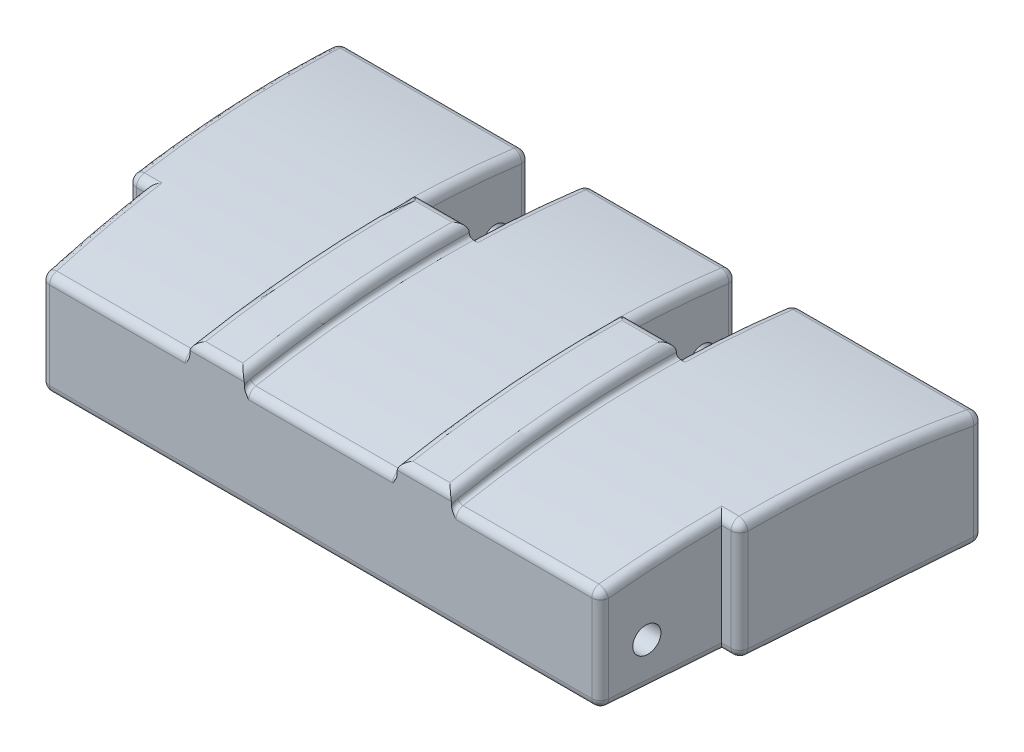
from build123d import *

# Parameters (mm, degrees)
EXTRUDE1_DEPTH                            = 3.556
EXTRUDE3_DEPTH                            = 17.59574656350235
EXTRUDE3_DEPTH_BACK                       = 17.59574656350235
EXTRUDE10_DEPTH                           = 3.9370000000000003
SURFACECUT2_START                         = -3.81
SURFACECUT2_DEPTH                         = 7.62
EXTRUDE11_REACH                           = 19.19
EXTRUDE11_OFFSET_FROM_SURFACE             = 0.508
SKETCH4_R                                 = 0.3809999999999997
EXTRUDE11_DIRECTION_2_REACH               = 19.19
EXTRUDE11_DIRECTION_2_OFFSET_FROM_SURFACE = 0.508
EXTRUDE12_DEPTH                           = 17.681535810590127
EXTRUDE12_DEPTH_BACK                      = 17.681535810590127
SKETCH6_R                                 = 0.38100000000000056
FILLET1_R                                 = 0.254
FILLET3_R                                 = 0.127


# Read off the part's stored shape, not the designer's step: SurfaceCut2
# Some blends are built 0.0001 mm under size
with BuildPart() as part:
    # Sketch1 → Extrude1 (new body)
    with BuildSketch(Plane(origin=(0, 0, 0), x_dir=(1, 0, 0), z_dir=(0, 1, 0))):
        Polygon((-9.397999999999994, 13.207999999999998), (-3.8100000000000067, 13.207999999999998), (-3.810000000000007, 9.846674305592273), (-2.222500000000007, 9.846674305592273), (-2.2225000000000072, 13.207999999999998), (2.2225000000000072, 13.207999999999998), (2.222500000000007, 9.846674305592273), (3.810000000000007, 9.846674305592273), (3.8100000000000067, 13.207999999999998), (9.398000000000005, 13.207999999999998), (8.889251839317405, 6.594273911126219), (8.379751097495415, 6.59427391112622), (8.126499258178015, 3.301999999999998), (2.222500000000007, 3.3019999999999987), (-2.222499999999993, 3.3019999999999987), (-8.126499258178017, 3.3019999999999947), (-8.379751097495415, 6.59427391112622), (-8.889251839317405, 6.594273911126219), align=None)
    extrude(amount=EXTRUDE1_DEPTH)

    # Sketch2 → Extrude3 (cut, two sides: drawn at the far end of the back side and taken through both)
    with BuildSketch(Plane(origin=(0, 0, 0), x_dir=(0, 0, -1), z_dir=(1, 0, 0)).offset(-EXTRUDE3_DEPTH_BACK)):
        with BuildLine():
            Line((43.794708499768134, -0.8831538826412886), (13.207999999999998, 3.2778165278608724))
            ThreePointArc((13.207999999999998, 3.2778165278608724), (8.243616493466815, 3.5439840518128456), (3.3019999999999996, 2.9995805413152166))
            Line((3.3019999999999996, 2.9995805413152166), (-27.002926673606563, -2.8716911194233727))
            Line((-27.002926673606563, -2.8716911194233727), (-28.736285079740515, 58.84084500625644))
            Line((-28.736285079740515, 58.84084500625644), (42.06135009363418, 60.82938224303852))
            Line((42.06135009363418, 60.82938224303852), (43.794708499768134, -0.8831538826412886))
        make_face()
    extrude(amount=EXTRUDE3_DEPTH + EXTRUDE3_DEPTH_BACK, mode=Mode.SUBTRACT)

    # Sketch3 → Extrude10 (add)
    with BuildSketch(Plane(origin=(0, 0, 0), x_dir=(1, 0, 0), z_dir=(0, 1, 0))):
        Polygon((-3.8100000000000076, 9.846674305592273), (-3.8100000000000067, 3.301999999999998), (-2.222500000000009, 3.301999999999998), (-2.222500000000009, 9.846674305592273), align=None)
    extrude10 = extrude(amount=EXTRUDE10_DEPTH)

    # Mirror1: Extrude10 across plane
    add(extrude10.mirror(Plane(origin=(0, 0, 0), x_dir=(0, 0, 1), z_dir=(1, 0, 0))))

    # SurfaceCut2 outline → SurfaceCut2 (cut)
    with BuildSketch(Plane.YZ.offset(SURFACECUT2_START)):
        with BuildLine():
            Line((3.937, -3.302), (3.387575238, -3.302))
            ThreePointArc((3.387575238, -3.302), (3.799336769, -6.187706563), (3.937, -9.099389713))
            Line((3.937, -9.099389713), (3.937, -3.302))
        make_face()
        with BuildLine():
            Line((3.937, -9.846674306), (3.937, -9.099389713))
            ThreePointArc((3.937, -9.099389713), (3.934737692, -9.473059402), (3.927951101, -9.846674306))
            Line((3.927951101, -9.846674306), (3.937, -9.846674306))
        make_face()
    extrude(amount=SURFACECUT2_DEPTH, mode=Mode.SUBTRACT)

    # Extrude11: up to this face of the body (flat: up to its plane, moved by the offset)
    extrude11_end = Plane(part.part.faces().sort_by_distance((-9.141501602, 1.743522756, -9.87352082))[0]).offset(-EXTRUDE11_OFFSET_FROM_SURFACE)
    # Sketch4 → Extrude11 (cut, up to the picked face)
    with BuildSketch(Plane(origin=(0, 0, 0), x_dir=(0, 0, -1), z_dir=(1, 0, 0)), mode=Mode.PRIVATE) as extrude11_sk1:
        with Locations(Location((12.191999999999995, 1.524, 0), (0, 0, 180))):
            Circle(SKETCH4_R)
    extrude11_tool1 = split(extrude(extrude11_sk1.sketch, amount=-EXTRUDE11_REACH, mode=Mode.PRIVATE), bisect_by=extrude11_end, keep=Keep.BOTH, mode=Mode.PRIVATE)
    add(extrude11_tool1.solids().sort_by(Axis((0, 1.524, -12.192), (-1, 0, 0)))[0], mode=Mode.SUBTRACT)

    # Extrude11 direction 2: up to this face of the body (flat: up to its plane, moved by the offset)
    extrude11_direction_2_end = Plane(part.part.faces().sort_by_distance((9.141501602, 1.743522756, -9.87352082))[0]).offset(-EXTRUDE11_DIRECTION_2_OFFSET_FROM_SURFACE)
    # Sketch4 → Extrude11 direction 2 (cut, up to the picked face)
    with BuildSketch(Plane(origin=(0, 0, 0), x_dir=(0, 0, -1), z_dir=(1, 0, 0)), mode=Mode.PRIVATE) as extrude11_direction_2_sk1:
        with Locations(Location((12.191999999999995, 1.524, 0), (0, 0, 180))):
            Circle(SKETCH4_R)
    extrude11_direction_2_tool1 = split(extrude(extrude11_direction_2_sk1.sketch, amount=EXTRUDE11_DIRECTION_2_REACH, mode=Mode.PRIVATE), bisect_by=extrude11_direction_2_end, keep=Keep.BOTH, mode=Mode.PRIVATE)
    add(extrude11_direction_2_tool1.solids().sort_by(Axis((0, 1.524, -12.192), (1, 0, 0)))[0], mode=Mode.SUBTRACT)

    # Sketch6 → Extrude12 (cut, two sides: drawn at the far end of the back side and taken through both)
    with BuildSketch(Plane(origin=(0, 0, 0), x_dir=(0, 0, -1), z_dir=(1, 0, 0)).offset(-EXTRUDE12_DEPTH_BACK)):
        with Locations((4.572, 1.27)):
            Circle(SKETCH6_R)
    extrude(amount=EXTRUDE12_DEPTH + EXTRUDE12_DEPTH_BACK, mode=Mode.SUBTRACT)

    # Fillet1
    fillet1_edges = [part.edges().sort_by_distance(p)[0] for p in [
        (-6.604000000000001, 0, -13.207999999999998),
        (-3.8100000000000067, 1.6389082639304369, -13.207999999999998),
        (-6.603999999999999, 3.2778165278608737, -13.207999999999998),
        (-9.397999999999994, 1.6389082639304369, -13.207999999999998),
        (-8.634501468406409, 0, -6.594273911126219),
        (-9.1436259196587, 0, -9.901136955563109),
        (-3.8100000000000067, 0, -11.527337152796136),
        (-3.016250000000007, 0, -9.846674305592273),
        (-2.2225000000000072, 0, -11.527337152796136),
        (0, 0, -13.207999999999998),
        (2.2225000000000072, 0, -11.527337152796136),
        (3.016250000000007, 0, -9.846674305592273),
        (3.8100000000000067, 0, -11.527337152796136),
        (6.604000000000006, 0, -13.207999999999998),
        (9.143625919658705, 0, -9.901136955563109),
        (8.634501468406409, 0, -6.594273911126219),
        (8.253125177836715, 0, -4.948136955563109),
        (0, 0, -3.301999999999996),
        (-8.253125177836715, 0, -4.948136955563108),
        (-3.810000000000007, 3.458846774792381, -11.531060312135633),
        (-9.240338326858652, 3.4863746094092, -11.158398249162493),
        (-8.985520849921244, 3.5302089081777552, -7.845771048976147),
        (-8.634501468406409, 3.452879279720044, -6.594273911126234),
        (-8.252649587288394, 3.271134219498723, -4.941954278434932),
        (-5.968249629089012, 2.9995805413152192, -3.302),
        (-8.889251839317405, 1.7264396398600215, -6.594273911126219),
        (-3.0162500000000048, 3.9279511010000023, -9.846674306),
        (-2.2225000000000072, 1.6389082639304369, -13.207999999999998),
        (-2.222500000000007, 3.458846774792381, -11.531060312135633),
        (2.2225000000000072, 1.6389082639304369, -13.207999999999998),
        (0, 3.2778165278608737, -13.207999999999998),
        (2.222500000000007, 3.458846774792381, -11.531060312135633),
        (3.016250000000005, 3.9279511010000023, -9.846674306),
        (3.8100000000000067, 1.6389082639304369, -13.207999999999998),
        (3.810000000000007, 3.458846774792381, -11.531060312135633),
        (9.398000000000005, 1.6389082639304369, -13.207999999999998),
        (6.604000000000006, 3.2778165278608737, -13.207999999999998),
        (8.889251839317405, 1.7264396398600215, -6.594273911126219),
        (8.985520849921246, 3.530208908177759, -7.845771048976157),
        (9.240338326858659, 3.4863746094091965, -11.15839824916253),
        (8.634501468406409, 3.452879279720044, -6.594273911126234),
        (8.126499258178015, 1.4997902706576096, -3.301999999999998),
        (8.252649587288396, 3.271134219498723, -4.9419542784349435),
        (-8.126499258178017, 1.4997902706576096, -3.3019999999999947),
        (-3.0162500000000048, 3.3875752380000037, -3.3019999999999987),
        (0, 2.9995805413152192, -3.302),
        (3.016250000000005, 3.3875752380000037, -3.3019999999999987),
        (5.96824962908901, 2.9995805413152192, -3.302),
        (-3.81, 3.7993367690405933, -6.18770656342829),
        (-3.81, 3.934737692001672, -9.473059401861846),
        (-2.222500000000009, 3.934737692001672, -9.473059401861844),
        (-2.222500000000009, 3.7993367690405933, -6.18770656342829),
        (3.81, 3.7993367690405933, -6.18770656342829),
        (3.81, 3.934737692001672, -9.473059401861846),
        (2.2225000000000095, 3.934737692001672, -9.473059401861844),
        (2.2225000000000095, 3.7993367690405933, -6.18770656342829),
    ]]
    fillet(fillet1_edges, radius=FILLET1_R - 0.0001)  # a hair under: the kernel refuses the full size

    # Fillet3
    # the kernel refuses this fillet: 0.127 mm, written as the material it adds along each edge
    with BuildSketch(Plane(origin=(-2.222500000000009, 2.789411835623188, -3.5558999999999994), x_dir=(0, -0.9492628631128058, 0.31448373044543665), z_dir=(0, -0.31448373044543665, -0.9492628631128058))) as fillet3_piece_1_section:
        with BuildLine():
            CenterArc((0.2539 + FILLET3_R, -FILLET3_R), FILLET3_R, 90, 90)
            Line((0.2539, -FILLET3_R), (0.2539, 0))
            Line((0.2539, 0), (0.2539 + FILLET3_R, 0))
        make_face()
    fillet3_piece_1 = revolve(axis=Axis((-2.222500000000009, 2.789411835623188, -3.5558999999999994), (-1, 0, 0)), revolution_arc=151.1024426013481, mode=Mode.PRIVATE)
    fillet3_piece_1 = split(fillet3_piece_1, bisect_by=Plane(origin=(-2.1857510015267803, 2.9566826021979615, -3.301999999999999), z_dir=(1.5e-16, 0, -1)), keep=Keep.TOP, mode=Mode.PRIVATE)
    add(fillet3_piece_1)
    with BuildSketch(Plane(origin=(2.222500000000009, 2.789411835623188, -3.5558999999999994), x_dir=(0, -0.9492628631128058, 0.31448373044543665), z_dir=(0, -0.31448373044543665, -0.9492628631128058))) as fillet3_piece_2_section:
        with BuildLine():
            CenterArc((0.2539 + FILLET3_R, FILLET3_R), FILLET3_R, 180, 90)
            Line((0.2539 + FILLET3_R, 0), (0.2539, 0))
            Line((0.2539, 0), (0.2539, FILLET3_R))
        make_face()
    fillet3_piece_2 = revolve(axis=Axis((2.222500000000009, 2.789411835623188, -3.5558999999999994), (-1, 0, 0)), revolution_arc=151.1024426013481, mode=Mode.PRIVATE)
    fillet3_piece_2 = split(fillet3_piece_2, bisect_by=Plane(origin=(2.185751000004183, 2.9566825922129487, -3.3019999999999987), z_dir=(1.5e-16, 0, -1)), keep=Keep.TOP, mode=Mode.PRIVATE)
    add(fillet3_piece_2)
    with BuildSketch(Plane(origin=(-3.8100000000000076, -26.9240000000004, -9.099389721885307), x_dir=(0, 0.9830382297293795, 0.18340076033246866), z_dir=(0, -0.18340076033246866, 0.9830382297293795))) as fillet3_piece_3_section:
        with BuildLine():
            CenterArc((30.4800000000004 + FILLET3_R, FILLET3_R), FILLET3_R, 180, 90)
            Line((30.4800000000004 + FILLET3_R, 0), (30.4800000000004, 0))
            Line((30.4800000000004, 0), (30.4800000000004, FILLET3_R))
        make_face()
    fillet3_piece_3 = revolve(axis=Axis((-3.8100000000000076, -26.9240000000004, -9.099389721885307), (-1, 0, 0)), revolution_arc=12.569616252405577, mode=Mode.PRIVATE)
    fillet3_piece_3 = split(fillet3_piece_3, bisect_by=Plane(origin=(-3.845214184277141, 3.4937088555039826, -9.846674305592273), z_dir=(0, 0, 1)), keep=Keep.TOP, mode=Mode.PRIVATE)
    add(fillet3_piece_3)
    with BuildSketch(Plane(origin=(-2.222500000000009, -26.9240000000004, -9.099389721885307), x_dir=(0, 0.9830382297293795, 0.18340076033246866), z_dir=(0, -0.18340076033246866, 0.9830382297293795))) as fillet3_piece_4_section:
        with BuildLine():
            CenterArc((30.4800000000004 + FILLET3_R, -FILLET3_R), FILLET3_R, 90, 90)
            Line((30.4800000000004, -FILLET3_R), (30.4800000000004, 0))
            Line((30.4800000000004, 0), (30.4800000000004 + FILLET3_R, 0))
        make_face()
    fillet3_piece_4 = revolve(axis=Axis((-2.222500000000009, -26.9240000000004, -9.099389721885307), (-1, 0, 0)), revolution_arc=12.569616252405577, mode=Mode.PRIVATE)
    fillet3_piece_4 = split(fillet3_piece_4, bisect_by=Plane(origin=(-2.1872858157475576, 3.493708855479379, -9.846674305592273), z_dir=(0, 0, 1)), keep=Keep.TOP, mode=Mode.PRIVATE)
    add(fillet3_piece_4)
    with BuildSketch(Plane(origin=(2.222500000000009, -26.9240000000004, -9.099389721885307), x_dir=(0, 0.9830382297293795, 0.18340076033246866), z_dir=(0, -0.18340076033246866, 0.9830382297293795))) as fillet3_piece_5_section:
        with BuildLine():
            CenterArc((30.4800000000004 + FILLET3_R, FILLET3_R), FILLET3_R, 180, 90)
            Line((30.4800000000004 + FILLET3_R, 0), (30.4800000000004, 0))
            Line((30.4800000000004, 0), (30.4800000000004, FILLET3_R))
        make_face()
    fillet3_piece_5 = revolve(axis=Axis((2.222500000000009, -26.9240000000004, -9.099389721885307), (-1, 0, 0)), revolution_arc=12.569616252405577, mode=Mode.PRIVATE)
    fillet3_piece_5 = split(fillet3_piece_5, bisect_by=Plane(origin=(2.1872858157228756, 3.4937088555039826, -9.846674305592273), z_dir=(0, 0, 1)), keep=Keep.TOP, mode=Mode.PRIVATE)
    add(fillet3_piece_5)
    with BuildSketch(Plane(origin=(3.8100000000000076, -26.9240000000004, -9.099389721885307), x_dir=(0, 0.9830382297293795, 0.18340076033246866), z_dir=(0, -0.18340076033246866, 0.9830382297293795))) as fillet3_piece_6_section:
        with BuildLine():
            CenterArc((30.4800000000004 + FILLET3_R, -FILLET3_R), FILLET3_R, 90, 90.00000000000034)
            Line((30.4800000000004, -FILLET3_R), (30.4800000000004, 0))
            Line((30.4800000000004, 0), (30.4800000000004 + FILLET3_R, 8.9e-16))
        make_face()
    fillet3_piece_6 = revolve(axis=Axis((3.8100000000000076, -26.9240000000004, -9.099389721885307), (-1, 0, 0)), revolution_arc=12.569616252405577, mode=Mode.PRIVATE)
    fillet3_piece_6 = split(fillet3_piece_6, bisect_by=Plane(origin=(3.845214184252458, 3.493708855479379, -9.846674305592273), z_dir=(0, 0, 1)), keep=Keep.TOP, mode=Mode.PRIVATE)
    add(fillet3_piece_6)
    with BuildSketch(Plane(origin=(-3.8100000000000067, 2.789411835623188, -3.5558999999999994), x_dir=(0, 0.9830382297293803, 0.18340076033246455), z_dir=(0, 0.18340076033246455, -0.9830382297293803))) as fillet3_piece_7_section:
        with BuildLine():
            CenterArc((0.2539 + FILLET3_R, -FILLET3_R), FILLET3_R, 90.00000000000007, 89.99999999999994)
            Line((0.2539 + FILLET3_R, 0), (0.2539, 0))
            Line((0.2539, 0), (0.2539000000000002, -FILLET3_R))
        make_face()
    fillet3_piece_7 = revolve(axis=Axis((-3.8100000000000067, 2.789411835623188, -3.5558999999999994), (1, 0, 0)), revolution_arc=151.10244260134797, mode=Mode.PRIVATE)
    fillet3_piece_7 = split(fillet3_piece_7, bisect_by=Plane(origin=(-3.8467487282956885, 2.9566826785720353, -3.3019999999999996), z_dir=(1.5e-16, 0, -1)), keep=Keep.TOP, mode=Mode.PRIVATE)
    add(fillet3_piece_7)
    with BuildSketch(Plane(origin=(3.810000000000006, 2.789411835623188, -3.5558999999999994), x_dir=(0, -0.9492628631128054, 0.3144837304454388), z_dir=(0, -0.3144837304454388, -0.9492628631128054))) as fillet3_piece_8_section:
        with BuildLine():
            CenterArc((0.2538999999999998 + FILLET3_R, -FILLET3_R), FILLET3_R, 90, 90)
            Line((0.2538999999999998, -FILLET3_R), (0.2538999999999998, -8.9e-16))
            Line((0.2538999999999998, -8.9e-16), (0.2538999999999998 + FILLET3_R, -8.9e-16))
        make_face()
    fillet3_piece_8 = revolve(axis=Axis((3.810000000000006, 2.789411835623188, -3.5558999999999994), (-1, 0, 0)), revolution_arc=151.10244260134797, mode=Mode.PRIVATE)
    fillet3_piece_8 = split(fillet3_piece_8, bisect_by=Plane(origin=(3.8467489999926876, 2.956682593248563, -3.3019999999999983), z_dir=(1.5e-16, 0, -1)), keep=Keep.TOP, mode=Mode.PRIVATE)
    add(fillet3_piece_8)


solid = part.part
